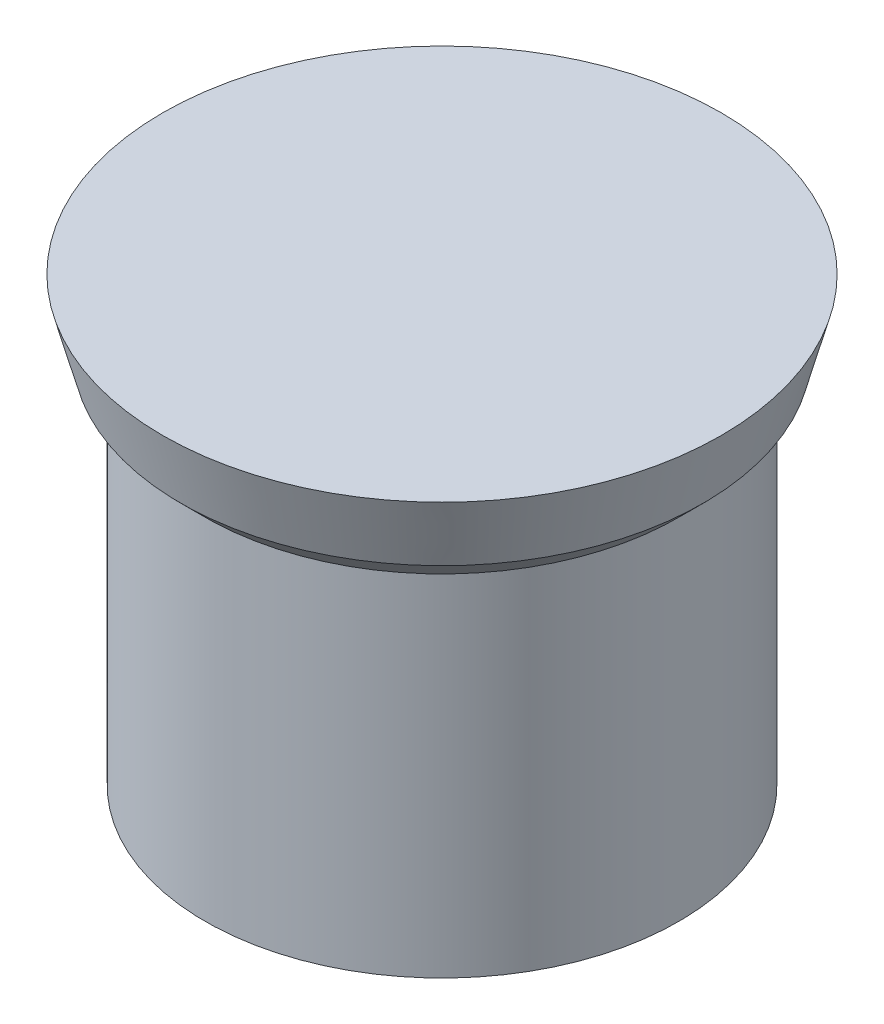
from build123d import *


with BuildPart() as part:
    # Sketch1 → Revolve1 (revolve)
    with BuildSketch(Plane.XY):
        Polygon((0, 0), (0, 16.3), (10.3, 16.3), (9.630127019, 13.8), (8.73125, 12.901122981), (8.73125, 0), align=None)
    revolve(axis=Axis((0, 0, 0), (0, 1, 0)))


solid = part.part
